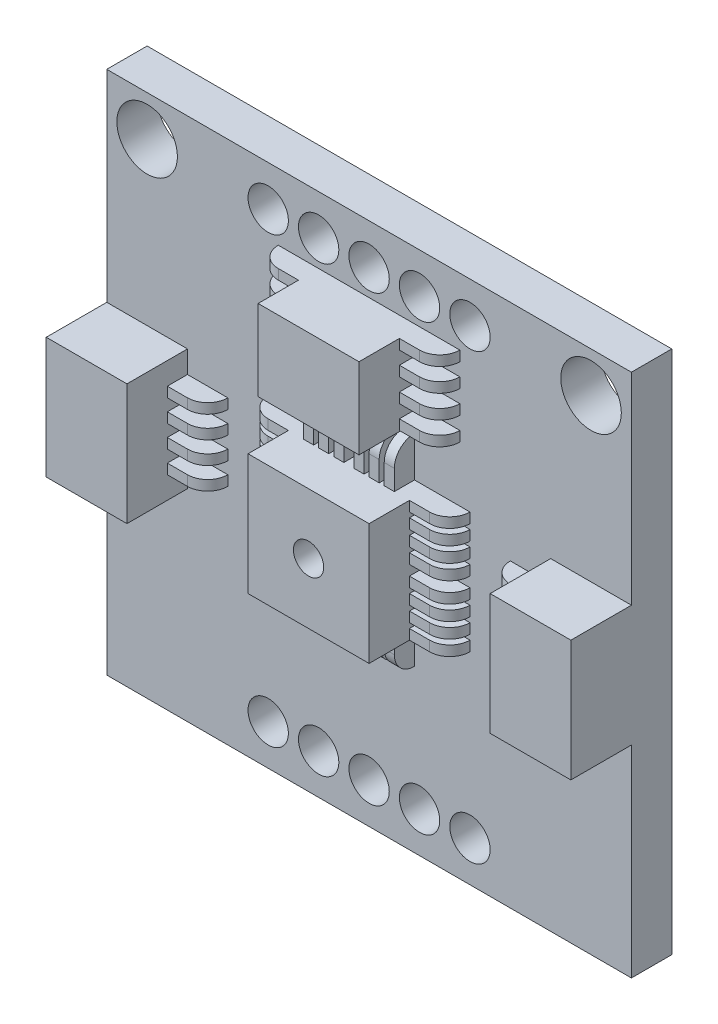
from build123d import *

# Parameters (mm, degrees)
SKETCH1_W           = 26
SKETCH1_H           = 26
BOSS_EXTRUDE1_DEPTH = 1
SKETCH2_W           = 6
SKETCH2_H           = 6
SKETCH2_R           = 0.75
BOSS_EXTRUDE2_DEPTH = 3
SKETCH4_W           = 2
SKETCH4_H           = 0.5
SKETCH4_W_2         = 0.5
SKETCH4_H_2         = 2
BOSS_EXTRUDE3_DEPTH = 1
FILLET1_R           = 1
SKETCH5_W           = 5
SKETCH5_H           = 4
SKETCH5_W_2         = 4
SKETCH5_H_2         = 6
BOSS_EXTRUDE4_DEPTH = 3
SKETCH6_W           = 2
SKETCH6_H           = 0.5
BOSS_EXTRUDE5_DEPTH = 1
FILLET2_R           = 1
SKETCH7_R           = 1.5
SKETCH7_R_2         = 1
CUT_EXTRUDE1_DEPTH  = 21


with BuildPart() as part:
    # Sketch1 → Boss-Extrude1 (new, symmetric)
    with BuildSketch(Plane.XY):
        Rectangle(SKETCH1_W, SKETCH1_H)
    extrude(amount=BOSS_EXTRUDE1_DEPTH, both=True)

    # Sketch2 → Boss-Extrude2 (add)
    with BuildSketch(Plane.XY.offset(1)):
        Rectangle(SKETCH2_W, SKETCH2_H)
        Circle(SKETCH2_R, mode=Mode.SUBTRACT)
    extrude(amount=BOSS_EXTRUDE2_DEPTH)

    # Sketch4 → Boss-Extrude3 (add)
    with BuildSketch(Plane.XY.offset(1)):
        with Locations((-4, 2.75)):
            Rectangle(SKETCH4_W, SKETCH4_H)
        with Locations((-4, 2)):
            Rectangle(SKETCH4_W, SKETCH4_H)
        with Locations((-4, 1.25)):
            Rectangle(SKETCH4_W, SKETCH4_H)
        with Locations((-4, 0.5)):
            Rectangle(SKETCH4_W, SKETCH4_H)
        with Locations((-4, -0.5)):
            Rectangle(SKETCH4_W, SKETCH4_H)
        with Locations((-4, -1.25)):
            Rectangle(SKETCH4_W, SKETCH4_H)
        with Locations((-4, -2)):
            Rectangle(SKETCH4_W, SKETCH4_H)
        with Locations((-4, -2.75)):
            Rectangle(SKETCH4_W, SKETCH4_H)
        with Locations((4, 2.75)):
            Rectangle(SKETCH4_W, SKETCH4_H)
        with Locations((4, -2.75)):
            Rectangle(SKETCH4_W, SKETCH4_H)
        with Locations((4, -2)):
            Rectangle(SKETCH4_W, SKETCH4_H)
        with Locations((4, -1.25)):
            Rectangle(SKETCH4_W, SKETCH4_H)
        with Locations((4, -0.5)):
            Rectangle(SKETCH4_W, SKETCH4_H)
        with Locations((4, 0.5)):
            Rectangle(SKETCH4_W, SKETCH4_H)
        with Locations((4, 1.25)):
            Rectangle(SKETCH4_W, SKETCH4_H)
        with Locations((4, 2)):
            Rectangle(SKETCH4_W, SKETCH4_H)
        with Locations((-2, -4)):
            Rectangle(SKETCH4_W_2, SKETCH4_H_2)
        with Locations((-1.25, -4)):
            Rectangle(SKETCH4_W_2, SKETCH4_H_2)
        with Locations((-0.5, -4)):
            Rectangle(SKETCH4_W_2, SKETCH4_H_2)
        with Locations((0.5, -4)):
            Rectangle(SKETCH4_W_2, SKETCH4_H_2)
        with Locations((1.25, -4)):
            Rectangle(SKETCH4_W_2, SKETCH4_H_2)
        with Locations((2, -4)):
            Rectangle(SKETCH4_W_2, SKETCH4_H_2)
        with Locations((2, 4)):
            Rectangle(SKETCH4_W_2, SKETCH4_H_2)
        with Locations((1.25, 4)):
            Rectangle(SKETCH4_W_2, SKETCH4_H_2)
        with Locations((0.5, 4)):
            Rectangle(SKETCH4_W_2, SKETCH4_H_2)
        with Locations((-0.5, 4)):
            Rectangle(SKETCH4_W_2, SKETCH4_H_2)
        with Locations((-1.25, 4)):
            Rectangle(SKETCH4_W_2, SKETCH4_H_2)
        with Locations((-2, 4)):
            Rectangle(SKETCH4_W_2, SKETCH4_H_2)
    extrude(amount=BOSS_EXTRUDE3_DEPTH)

    # Fillet1
    fillet1_edges = [part.edges().sort_by_distance(p)[0] for p in [
        (2, 5, 2),
        (1.25, 5, 2),
        (0.5, 5, 2),
        (-0.5, 5, 2),
        (-1.25, 5, 2),
        (-2, 5, 2),
        (-5, 0.5, 2),
        (-5, 1.25, 2),
        (-5, 2, 2),
        (-5, 2.75, 2),
        (-5, -0.5, 2),
        (-5, -1.25, 2),
        (-5, -2, 2),
        (-5, -2.75, 2),
        (-2, -5, 2),
        (-1.25, -5, 2),
        (-0.5, -5, 2),
        (0.5, -5, 2),
        (1.25, -5, 2),
        (2, -5, 2),
        (5, 2.75, 2),
        (5, 2, 2),
        (5, 1.25, 2),
        (5, 0.5, 2),
        (5, -0.5, 2),
        (5, -1.25, 2),
        (5, -2, 2),
        (5, -2.75, 2),
    ]]
    fillet(fillet1_edges, radius=FILLET1_R - 0.0001)  # a hair under: the kernel refuses the full size

    # Sketch5 → Boss-Extrude4 (add)
    with BuildSketch(Plane.XY.offset(1)):
        with Locations((0, 7.7)):
            Rectangle(SKETCH5_W, SKETCH5_H)
        with Locations((-11, 0)):
            Rectangle(SKETCH5_W_2, SKETCH5_H_2)
        with Locations((11, 0)):
            Rectangle(SKETCH5_W_2, SKETCH5_H_2)
    extrude(amount=BOSS_EXTRUDE4_DEPTH)

    # Sketch6 → Boss-Extrude5 (add)
    with BuildSketch(Plane.XY.offset(1)):
        with Locations((-3.5, 9.45)):
            Rectangle(SKETCH6_W, SKETCH6_H)
        with Locations((-3.5, 8.3)):
            Rectangle(SKETCH6_W, SKETCH6_H)
        with Locations((-3.5, 7.15)):
            Rectangle(SKETCH6_W, SKETCH6_H)
        with Locations((-3.5, 6)):
            Rectangle(SKETCH6_W, SKETCH6_H)
        with Locations((-8, 1.65)):
            Rectangle(SKETCH6_W, SKETCH6_H)
        with Locations((-8, 0.55)):
            Rectangle(SKETCH6_W, SKETCH6_H)
        with Locations((-8, -0.55)):
            Rectangle(SKETCH6_W, SKETCH6_H)
        with Locations((-8, -1.65)):
            Rectangle(SKETCH6_W, SKETCH6_H)
        with Locations((3.5, 6)):
            Rectangle(SKETCH6_W, SKETCH6_H)
        with Locations((3.5, 7.15)):
            Rectangle(SKETCH6_W, SKETCH6_H)
        with Locations((3.5, 8.3)):
            Rectangle(SKETCH6_W, SKETCH6_H)
        with Locations((3.5, 9.45)):
            Rectangle(SKETCH6_W, SKETCH6_H)
        with Locations((8, -1.65)):
            Rectangle(SKETCH6_W, SKETCH6_H)
        with Locations((8, -0.55)):
            Rectangle(SKETCH6_W, SKETCH6_H)
        with Locations((8, 0.55)):
            Rectangle(SKETCH6_W, SKETCH6_H)
        with Locations((8, 1.65)):
            Rectangle(SKETCH6_W, SKETCH6_H)
    extrude(amount=BOSS_EXTRUDE5_DEPTH)

    # Fillet2
    fillet2_edges = [part.edges().sort_by_distance(p)[0] for p in [
        (-4.5, 6, 2),
        (-4.5, 7.15, 2),
        (-4.5, 8.3, 2),
        (-4.5, 9.45, 2),
        (-7, -1.65, 2),
        (-7, -0.55, 2),
        (-7, 0.55, 2),
        (-7, 1.65, 2),
        (7, -1.65, 2),
        (7, 0.55, 2),
        (7, -0.55, 2),
        (7, 1.65, 2),
        (4.5, 6, 2),
        (4.5, 7.15, 2),
        (4.5, 8.3, 2),
        (4.5, 9.45, 2),
    ]]
    fillet(fillet2_edges, radius=FILLET2_R - 0.0001)  # a hair under: the kernel refuses the full size

    # Sketch7 → Cut-Extrude1 (cut)
    with BuildSketch(Plane.XY.offset(1)):
        with Locations((-11, 11)):
            Circle(SKETCH7_R)
        with Locations((11, 11)):
            Circle(SKETCH7_R)
        with Locations((-5, 11)):
            Circle(SKETCH7_R_2)
        with Locations((-2.5, 11)):
            Circle(SKETCH7_R_2)
        with Locations((0, 11)):
            Circle(SKETCH7_R_2)
        with Locations((2.5, 11)):
            Circle(SKETCH7_R_2)
        with Locations((5, 11)):
            Circle(SKETCH7_R_2)
        with Locations((5, -11)):
            Circle(SKETCH7_R_2)
        with Locations((2.5, -11)):
            Circle(SKETCH7_R_2)
        with Locations((0, -11)):
            Circle(SKETCH7_R_2)
        with Locations((-2.5, -11)):
            Circle(SKETCH7_R_2)
        with Locations((-5, -11)):
            Circle(SKETCH7_R_2)
    extrude(amount=-CUT_EXTRUDE1_DEPTH, mode=Mode.SUBTRACT)


solid = part.part
